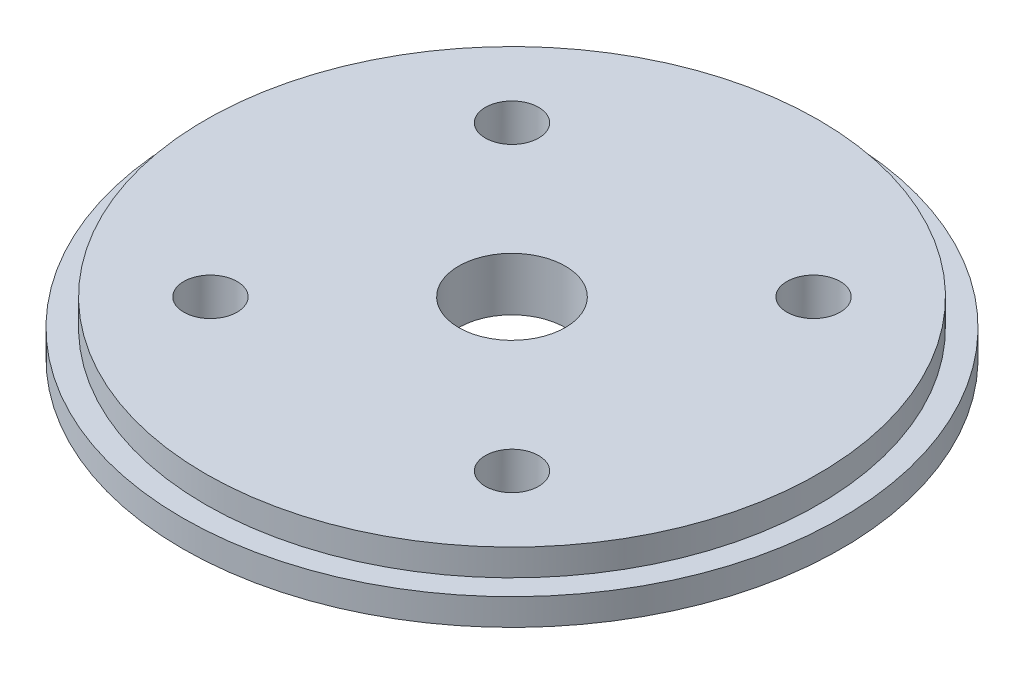
from build123d import *

# Parameters (mm, degrees)
SKETCH2_R                   = 39.2557
BOSS_EXTRUDE1_DEPTH         = 6.35
CUT_EXTRUDE1_START          = -3.175
SKETCH4_R                   = 39.2557
SKETCH4_R_2                 = 36.5125
CUT_EXTRUDE1_DEPTH          = 3.175
F_1_4_0_25_DIAMETER_HOLE1_D = 6.35
F_1_2_0_5_DIAMETER_HOLE1_D  = 12.7
SKETCH9_R                   = 6.0325
CUT_EXTRUDE2_DEPTH          = 1.5875


with BuildPart() as part:
    # Sketch2 → Boss-Extrude1 (new body)
    with BuildSketch(Plane(origin=(0, 0, 0), x_dir=(1, 0, 0), z_dir=(0, 1, 0))):
        Circle(SKETCH2_R)
    extrude(amount=BOSS_EXTRUDE1_DEPTH)

    # Sketch4 → Cut-Extrude1 (cut)
    with BuildSketch(Plane(origin=(0, 6.35, 0), x_dir=(1, 0, 0), z_dir=(0, 1, 0)).offset(CUT_EXTRUDE1_START)):
        Circle(SKETCH4_R)
        Circle(SKETCH4_R_2, mode=Mode.SUBTRACT)
    extrude(amount=CUT_EXTRUDE1_DEPTH, mode=Mode.SUBTRACT)

    # 1/4 (0.25) Diameter Hole1 (through all)
    with Locations(Plane(origin=(0, 6.35, 0), x_dir=(1, 0, 0), z_dir=(0, 1, 0))):
        with Locations((-17.960512242, 17.960512242), (-17.960512242, -17.960512242), (17.960512242, 17.960512242), (17.960512242, -17.960512242)):
            Hole(F_1_4_0_25_DIAMETER_HOLE1_D / 2)

    # 1/2 (0.5) Diameter Hole1 (through all)
    with Locations(Plane(origin=(0, 6.35, 0), x_dir=(1, 0, 0), z_dir=(0, 1, 0))):
        with Locations((0, 0)):
            Hole(F_1_2_0_5_DIAMETER_HOLE1_D / 2)

    # Sketch9 → Cut-Extrude2 (cut)
    with BuildSketch(Plane.XZ):
        with Locations((-17.960512242, 17.960512242)):
            Circle(SKETCH9_R)
        with Locations((17.960512242, 17.960512242)):
            Circle(SKETCH9_R)
        with Locations((17.960512242, -17.960512242)):
            Circle(SKETCH9_R)
        with Locations((-17.960512242, -17.960512242)):
            Circle(SKETCH9_R)
    extrude(amount=-CUT_EXTRUDE2_DEPTH, mode=Mode.SUBTRACT)


solid = part.part
